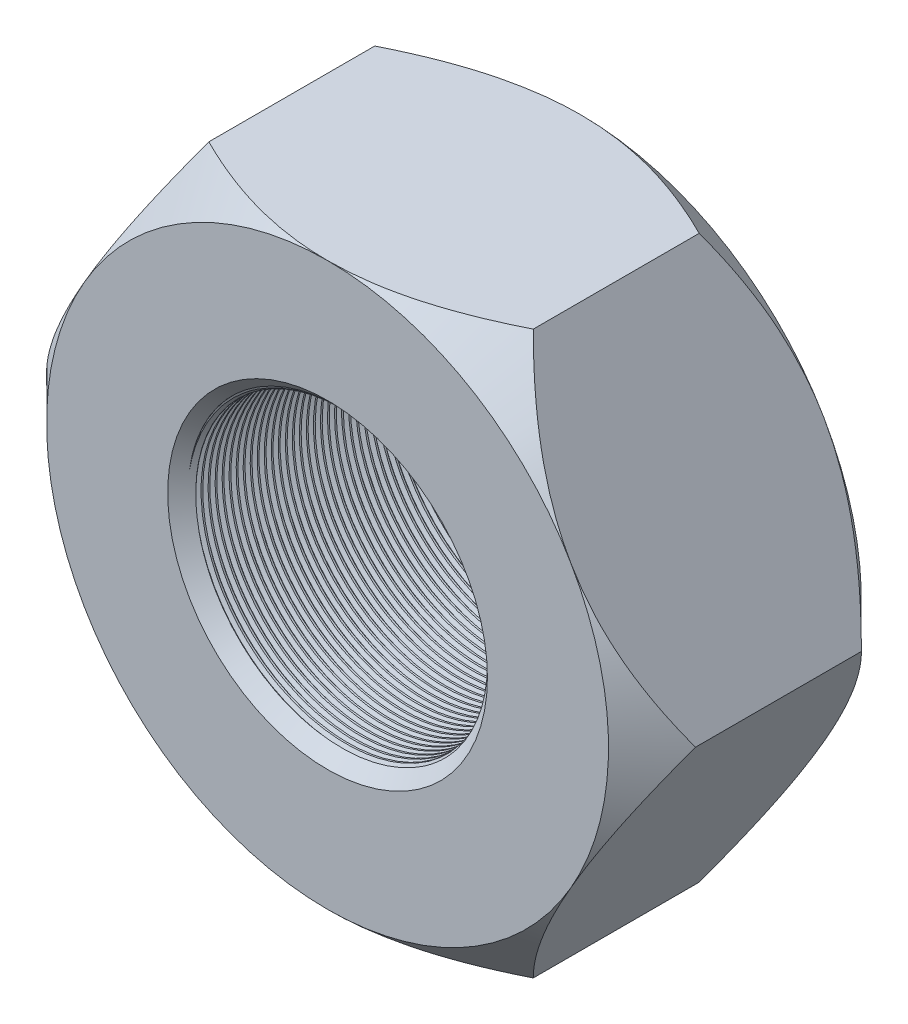
from build123d import *

# Parameters (mm, degrees)
BOSS_EXTRUDE1_DEPTH     = 4.5
SKETCH2_OUTSIDE_W       = 68.922
SKETCH2_OUTSIDE_H       = 65.828
SKETCH2_OUTSIDE_R       = 10
CUT_EXTRUDE1_DEPTH      = 18.729448196
CUT_EXTRUDE1_DRAFT      = -45
MIRROR1_COPY_1_SKETCH_W = 68.922
MIRROR1_COPY_1_SKETCH_H = 65.828
MIRROR1_COPY_1_SKETCH_R = 10
MIRROR1_COPY_1_DEPTH    = 18.729448196
MIRROR1_COPY_1_DRAFT    = -45
SKETCH3_R               = 5.19
CUT_EXTRUDE2_DEPTH      = 18.729448196
CHAMFER1_SIZE           = 0.5
THREAD1_PITCH           = 0.25


with BuildPart() as part:
    # Sketch1 → Boss-Extrude1 (new, symmetric)
    with BuildSketch(Plane.XY):
        Polygon((-5.773502692, -10), (5.773502692, -10), (11.547005384, 0), (5.773502692, 10), (-5.773502692, 10), (-11.547005384, 0), align=None)
    extrude(amount=BOSS_EXTRUDE1_DEPTH, both=True)


with BuildPart() as cut_extrude1_tool:
    # Sketch2 outside → Cut-Extrude1 (with draft: the straight prism first)
    with BuildSketch(Plane(origin=(0, 0, -4.5), x_dir=(-1, 0, 0), z_dir=(0, 0, -1))):
        Rectangle(SKETCH2_OUTSIDE_W, SKETCH2_OUTSIDE_H)
        Circle(SKETCH2_OUTSIDE_R, mode=Mode.SUBTRACT)
    extrude(amount=-CUT_EXTRUDE1_DEPTH)
    # Cut-Extrude1: the draft: its side faces are tilted about the plane it starts from
    cut_extrude1_sides = [cut_extrude1_tool.faces().sort_by_distance(p)[0] for p in [
        (0, -32.914, 4.864724098),
        (-34.461, 0, 4.864724098),
        (0, 32.914, 4.864724098),
        (34.461, 0, 4.864724098),
        (10, 0, 4.864724098),
    ]]
    draft(cut_extrude1_sides, Plane(origin=(0, 0, -4.5), x_dir=(-1, 0, 0), z_dir=(0, 0, -1)), CUT_EXTRUDE1_DRAFT)


with BuildPart() as part_1:
    add(part.part)

    # Cut-Extrude1: cut by cut_extrude1_tool
    add(cut_extrude1_tool.part, mode=Mode.SUBTRACT)


with BuildPart() as mirror1_copy_1_tool:
    # Mirror1 copy 1 sketch → Mirror1 copy 1 (with draft: the straight prism first)
    with BuildSketch(Plane(origin=(0, 0, 4.5), x_dir=(-1, 0, 0), z_dir=(0, 0, 1))):
        Rectangle(MIRROR1_COPY_1_SKETCH_W, MIRROR1_COPY_1_SKETCH_H)
        Circle(MIRROR1_COPY_1_SKETCH_R, mode=Mode.SUBTRACT)
    extrude(amount=-MIRROR1_COPY_1_DEPTH)
    # Mirror1 copy 1: the draft: its side faces are tilted about the plane it starts from
    mirror1_copy_1_sides = [mirror1_copy_1_tool.faces().sort_by_distance(p)[0] for p in [
        (0, -32.914, -4.864724098),
        (-34.461, 0, -4.864724098),
        (0, 32.914, -4.864724098),
        (34.461, 0, -4.864724098),
        (10, 0, -4.864724098),
    ]]
    draft(mirror1_copy_1_sides, Plane(origin=(0, 0, 4.5), x_dir=(-1, 0, 0), z_dir=(0, 0, 1)), MIRROR1_COPY_1_DRAFT)


with BuildPart() as part_2:
    add(part_1.part)

    # Mirror1 copy 1: cut by mirror1_copy_1_tool
    add(mirror1_copy_1_tool.part, mode=Mode.SUBTRACT)

    # Sketch3 → Cut-Extrude2 (cut, through all)
    with BuildSketch(Plane(origin=(0, 0, -4.5), x_dir=(-1, 0, 0), z_dir=(0, 0, -1))):
        Circle(SKETCH3_R)
    extrude(amount=-CUT_EXTRUDE2_DEPTH, mode=Mode.SUBTRACT)

    # Chamfer1
    chamfer1_edges = [part_2.edges().sort_by_distance(p)[0] for p in [
        (5.19, 0, 4.5),
        (5.19, 0, -4.5),
    ]]
    chamfer(chamfer1_edges, length=CHAMFER1_SIZE)

    # Thread1: the profile of Thread Profile3 profile screwed along a right-hand helix of 42 turns, 6 arcs to a turn; built about Z, then put on its axis
    thread1_z = Axis((0, 0, 0), (0, 0, 1))
    thread1_corners = [(5.1897, 0, -0.000173205), (5.325316469, 0, 0.078125), (5.325316469, 0, 0.109375), (5.1897, 0, 0.187673204)]
    with BuildLine(mode=Mode.PRIVATE) as thread1_profile:
        Line(thread1_corners[0], thread1_corners[1])
        Line(thread1_corners[1], thread1_corners[2])
        Line(thread1_corners[2], thread1_corners[3])
        Line(thread1_corners[3], thread1_corners[0])
    thread1_cap = Face(thread1_profile.wire())
    thread1_turn_angles = [0, 30, 60, 90, 120, 150, 180, 210, 240, 270, 300, 330, 360, 390, 420, 450, 480, 510, 540, 570, 600, 630, 660, 690, 720]
    thread1_turn_weights = [1, 0.8660254037844387, 1, 0.8660254037844387, 1, 0.8660254037844387, 1, 0.8660254037844387, 1, 0.8660254037844387, 1, 0.8660254037844387, 1, 0.8660254037844387, 1, 0.8660254037844387, 1, 0.8660254037844387, 1, 0.8660254037844387, 1, 0.8660254037844387, 1, 0.8660254037844387, 1]
    thread1_turn_rails = [Edge.make_bspline([Vector(p[0], p[1], 0).rotate(thread1_z, thread1_turn_angles[k]) / thread1_turn_weights[k] + Vector(0, 0, p[2] + THREAD1_PITCH * thread1_turn_angles[k] / 360) for k in range(25)], [0, 0, 0, 1, 1, 2, 2, 3, 3, 4, 4, 5, 5, 6, 6, 7, 7, 8, 8, 9, 9, 10, 10, 11, 11, 12, 12, 12], 2, thread1_turn_weights) for p in thread1_corners]
    thread1_turn_sides = [Face.make_surface_from_curves(thread1_turn_rails[p[0]], thread1_turn_rails[p[1]]) for p in [(0, 1), (1, 2), (2, 3), (3, 0)]]
    thread1 = Plane(origin=(0, 0, 6), x_dir=(-1, 0, 0), z_dir=(0, 0, -1)) * Solid(Shell([*[p.moved(Location((0, 0, 2 * THREAD1_PITCH * i))) for i in range(21) for p in thread1_turn_sides], thread1_cap, thread1_cap.rotate(thread1_z, 15120).moved(Location((0, 0, THREAD1_PITCH * 15120 / 360)))]))
    add(thread1, mode=Mode.SUBTRACT)


solid = part_2.part
